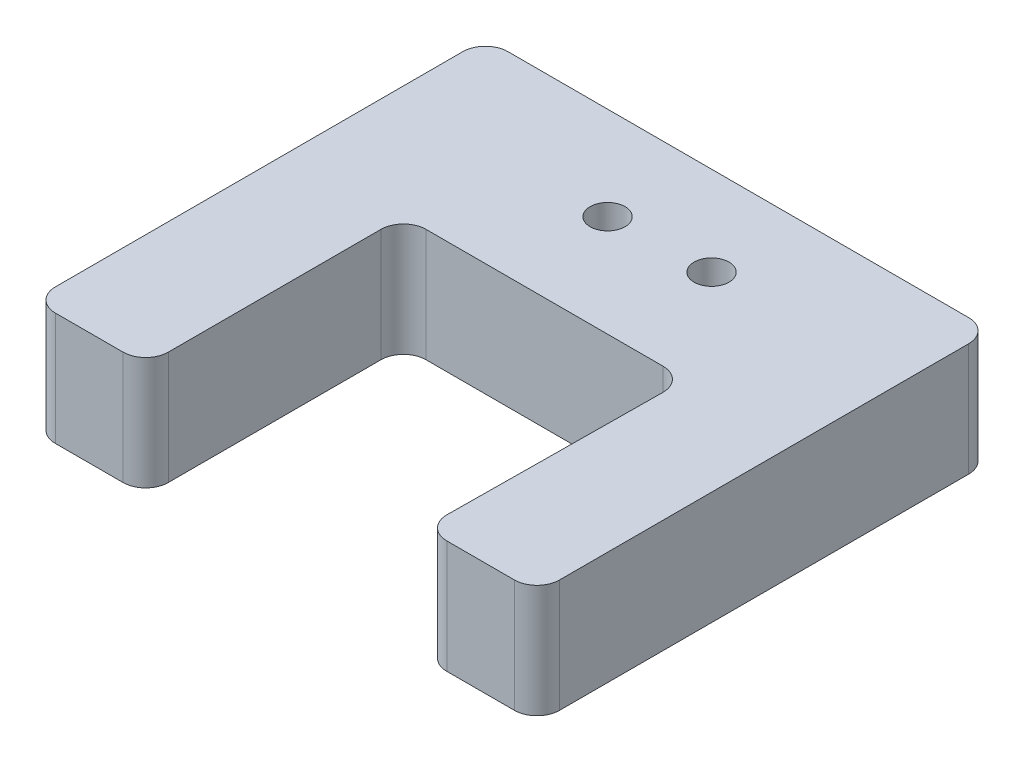
from build123d import *

# Parameters (mm, degrees)
EXTRUDE_1_DEPTH     = 10
SKETCH_2_R          = 4
CUT_EXTRUDE_2_DEPTH = 4
SKETCH_3_R          = 1.544498182
CUT_EXTRUDE_3_DEPTH = 6


with BuildPart() as part:
    # 草图1 → 凸台-拉伸1 (new body)
    with BuildSketch(Plane(origin=(0, 0, 0), x_dir=(1, 0, 0), z_dir=(0, 1, 0))):
        with BuildLine():
            Line((-31.00747428, -14.016732478), (-37.00747428, -14.016732478))
            ThreePointArc((-37.00747428, -14.016732478), (-38.421687843, -13.430946041), (-39.00747428, -12.016732478))
            Line((-39.00747428, -12.016732478), (-39.00747428, 24.056652611))
            ThreePointArc((-39.00747428, 24.056652611), (-38.421687843, 25.470866173), (-37.00747428, 26.056652611))
            Line((-37.00747428, 26.056652611), (3.777463104, 26.056652611))
            ThreePointArc((3.777463104, 26.056652611), (5.191676666, 25.470866173), (5.777463104, 24.056652611))
            Line((5.777463104, 24.056652611), (5.777463104, -12.160659944))
            ThreePointArc((5.777463104, -12.160659944), (5.191676666, -13.574873507), (3.777463104, -14.160659944))
            Line((3.777463104, -14.160659944), (-2.203720449, -14.160659944))
            ThreePointArc((-2.203720449, -14.160659944), (-3.624539909, -13.568236608), (-4.203632763, -12.141932009))
            Line((-4.203632763, -12.141932009), (-4.026378413, 6.786644089))
            ThreePointArc((-4.026378413, 6.786644089), (-4.605471268, 8.212948689), (-6.026290727, 8.805372025))
            Line((-6.026290727, 8.805372025), (-27.00747428, 8.805372025))
            ThreePointArc((-27.00747428, 8.805372025), (-28.421687843, 8.219585587), (-29.00747428, 6.805372025))
            Line((-29.00747428, 6.805372025), (-29.00747428, -12.016732478))
            ThreePointArc((-29.00747428, -12.016732478), (-29.593260718, -13.430946041), (-31.00747428, -14.016732478))
        make_face()
    extrude(amount=EXTRUDE_1_DEPTH)

    # 草图2 → 切除-拉伸2 (cut)
    with BuildSketch(Plane(origin=(0, 0, 0), x_dir=(1, 0, 0), z_dir=(0, 1, 0))):
        with Locations((-19.848061649, 17.902553063)):
            Circle(SKETCH_2_R)
        with Locations((-10.848061649, 18.277501013)):
            Circle(SKETCH_2_R)
    extrude(amount=CUT_EXTRUDE_2_DEPTH, mode=Mode.SUBTRACT)

    # 草图3 → 切除-拉伸3 (cut)
    with BuildSketch(Plane(origin=(0, 4, 0), x_dir=(-1, 0, 0), z_dir=(0, -1, 0))):
        with Locations((19.943988939, 17.812586933)):
            Circle(SKETCH_3_R)
        with Locations((11.092287237, 18.162852298)):
            Circle(SKETCH_3_R)
    extrude(amount=-CUT_EXTRUDE_3_DEPTH, mode=Mode.SUBTRACT)


solid = part.part
